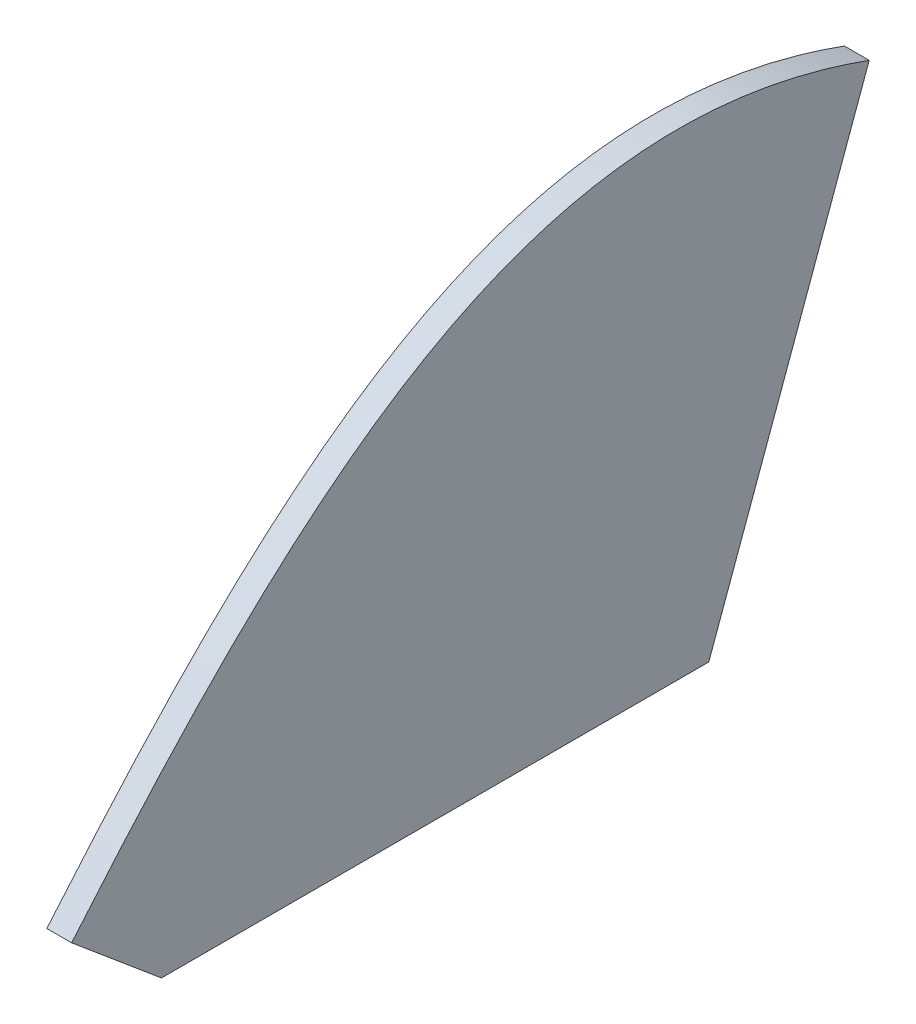
from build123d import *

# Parameters (mm, degrees)
BOSS_EXTRUDE1_DEPTH = 3.175


with BuildPart() as part:
    # Sketch1 → Boss-Extrude1 (new body)
    with BuildSketch(Plane(origin=(0, 0, 0), x_dir=(0, 0, -1), z_dir=(1, 0, 0))):
        with BuildLine():
            Line((0, 0), (70, 0))
            Line((70, 0), (90.5212086, 56.381557247))
            add(Edge.make_bspline(
                [(-11.490666647, 9.641814145), (19.4560829, 46.522714097), (48.01605029, 71.852169675), (90.5212086, 56.381557247)],
                knots=[0, 0, 0, 0, 1, 1, 1, 1], degree=3))
            Line((-11.490666647, 9.641814145), (0, 0))
        make_face()
    extrude(amount=BOSS_EXTRUDE1_DEPTH)


solid = part.part
